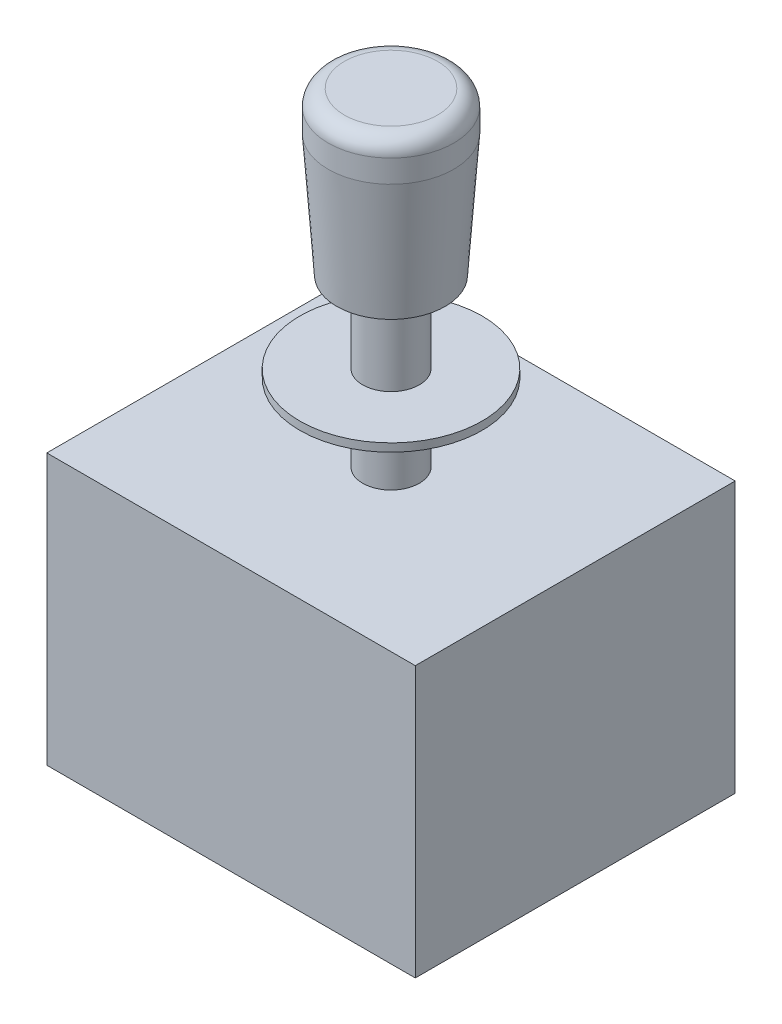
from build123d import *

# Parameters (mm, degrees)
SKETCH2_W           = 15.5
SKETCH2_H           = 2
SKETCH3_W           = 91
SKETCH3_H           = 79
BOSS_EXTRUDE1_DEPTH = 66.8


with BuildPart() as part:
    # Sketch1 → Revolve1 (revolve)
    with BuildSketch(Plane.XY):
        with BuildLine():
            Line((0, 0), (-7, 0))
            Line((-7, 0), (-7, 41))
            Line((-7, 41), (-13.369653316, 41))
            Line((-13.369653316, 41), (-15.5, 71.401844965))
            Line((-15.5, 71.401844965), (-15.5, 77))
            ThreePointArc((-15.5, 77), (-14.328427125, 79.828427125), (-11.5, 81))
            Line((-11.5, 81), (0, 81))
            Line((0, 81), (0, 0))
        make_face()
    revolve(axis=Axis((0, 0, 0), (0, -1, 0)))

    # Sketch2 → Revolve2 (revolve)
    with BuildSketch(Plane.XY):
        with Locations((-14.75, 20.05)):
            Rectangle(SKETCH2_W, SKETCH2_H)
    revolve(axis=Axis((0, 0, 0), (0, 1, 0)))

    # Sketch3 → Boss-Extrude1 (add)
    with BuildSketch(Plane.XZ):
        Rectangle(SKETCH3_W, SKETCH3_H)
    extrude(amount=BOSS_EXTRUDE1_DEPTH)


solid = part.part
